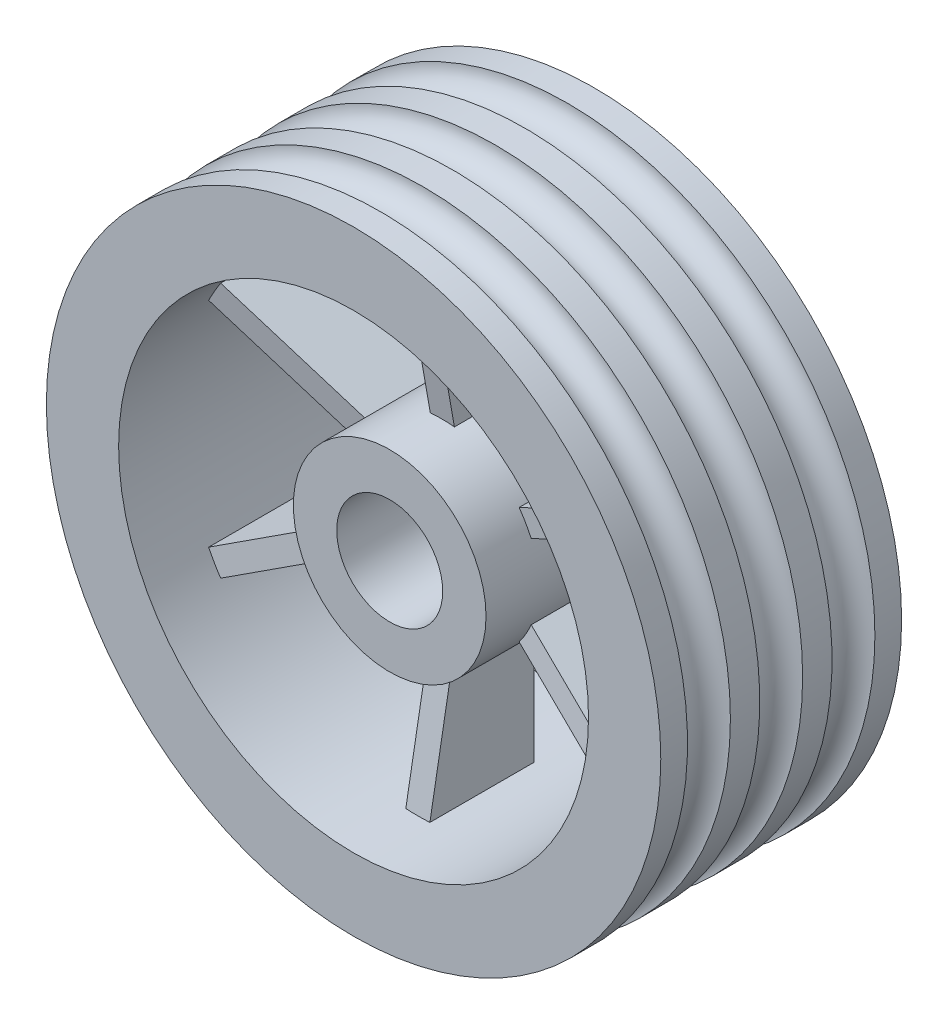
from build123d import *

# Parameters (mm, degrees)
SKETCH1_R           = 12.755
SKETCH1_R_2         = 9.755
BOSS_EXTRUDE1_DEPTH = 10
SKETCH2_R           = 4
SKETCH2_R_2         = 2.2
BOSS_EXTRUDE2_DEPTH = 8.5
BOSS_EXTRUDE3_DEPTH = 0.5
CIRPATTERN1_COUNT   = 6
SKETCH7_R           = 0.89


with BuildPart() as part:
    # Sketch1 → Boss-Extrude1 (new body)
    with BuildSketch(Plane.XY):
        Circle(SKETCH1_R)
        Circle(SKETCH1_R_2, mode=Mode.SUBTRACT)
    extrude(amount=BOSS_EXTRUDE1_DEPTH)



with BuildPart() as body_2:
    # Sketch2 → Boss-Extrude2 (new body)
    with BuildSketch(Plane.XY):
        Circle(SKETCH2_R)
        Circle(SKETCH2_R_2, mode=Mode.SUBTRACT)
    extrude(amount=BOSS_EXTRUDE2_DEPTH)


with BuildPart() as part_1:
    add(part.part)

    add(body_2.part)  # Boss-Extrude3 merges body 2
    # Sketch5 → Boss-Extrude3 (add, symmetric)
    with BuildSketch(Plane(origin=(0, 0, 0), x_dir=(0, 0, -1), z_dir=(1, 0, 0))):
        Polygon((-3, 2.2), (-3, 10.7), (-7.5, 10.7), (-6, 2.2), align=None)
    boss_extrude3 = extrude(amount=BOSS_EXTRUDE3_DEPTH, both=True)

    # CirPattern1: Boss-Extrude3 ×6 about axis
    cirpattern1_axis = Axis((0, 0, 8.5), (0, 0, -1))
    for i in range(1, CIRPATTERN1_COUNT):
        add(boss_extrude3.rotate(cirpattern1_axis, i * 360 / CIRPATTERN1_COUNT))

    # Sketch7 → Cut-Revolve1 (revolve, cut)
    with BuildSketch(Plane(origin=(0, 0, 0), x_dir=(0, 0, -1), z_dir=(1, 0, 0))):
        with Locations((-5, 12.755)):
            Circle(SKETCH7_R)
        with Locations((-2, 12.755)):
            Circle(SKETCH7_R)
        with Locations((-8, 12.755)):
            Circle(SKETCH7_R)
    revolve(axis=Axis((0, 0, 0), (0, 0, 1)), mode=Mode.SUBTRACT)


solid = part_1.part
